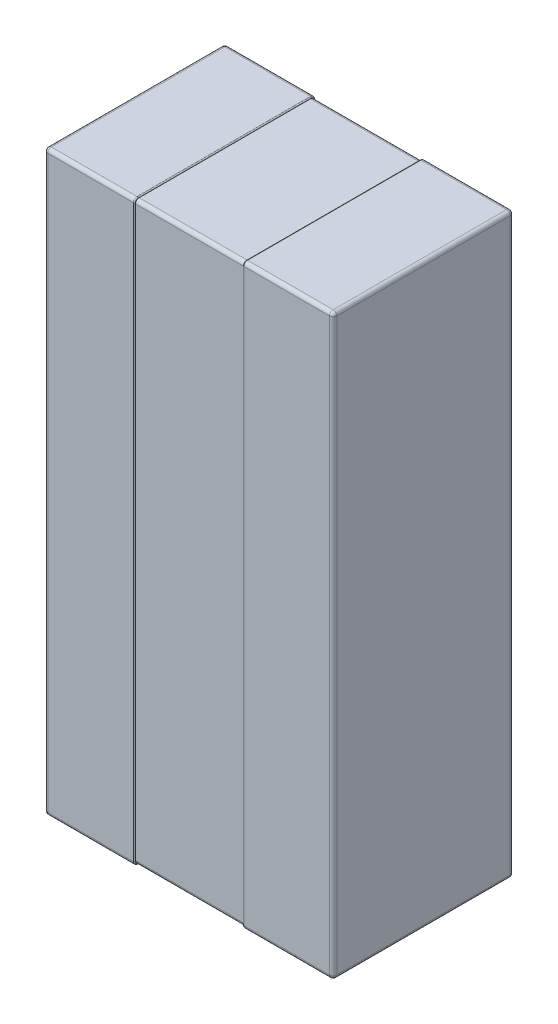
from build123d import *

# Parameters (mm, degrees)
SKETCH1_W                           = 0.8
SKETCH1_H                           = 1.6
ALL_BODY_DEPTH                      = 0.5
CUT_OUT_THE_BODY_FOR_PIN_DEPTH      = 0.15
CUT_OUT_THE_BODY_FOR_PIN_DEPTH_BACK = 0.15
SKETCH2_OUTSIDE_W                   = 2.872
SKETCH2_OUTSIDE_H                   = 3.972
SKETCH2_OUTSIDE_W_2                 = 0.494
SKETCH2_OUTSIDE_H_2                 = 1.594
BODY_FILLET_R                       = 0.01
PIN_FILLET_A_R                      = 0.01
PIN_FILLET_B_R                      = 0.003


with BuildPart() as part:
    # Sketch1 → All body (new body)
    with BuildSketch(Plane.XY):
        Rectangle(SKETCH1_W, SKETCH1_H)
    extrude(amount=ALL_BODY_DEPTH)

    # Sketch2 outside → Cut out the body for pin (cut, two sides: drawn at the far end of the back side and taken through both)
    with BuildSketch(Plane(origin=(0, 0, 0), x_dir=(0, 0, -1), z_dir=(1, 0, 0)).offset(-CUT_OUT_THE_BODY_FOR_PIN_DEPTH_BACK)):
        with Locations((-0.25, 0)):
            Rectangle(SKETCH2_OUTSIDE_W, SKETCH2_OUTSIDE_H)
        with Locations((-0.25, 0)):
            Rectangle(SKETCH2_OUTSIDE_W_2, SKETCH2_OUTSIDE_H_2, mode=Mode.SUBTRACT)
    extrude(amount=CUT_OUT_THE_BODY_FOR_PIN_DEPTH + CUT_OUT_THE_BODY_FOR_PIN_DEPTH_BACK, mode=Mode.SUBTRACT)

    # Body fillet
    body_fillet_edges = [part.edges().sort_by_distance(p)[0] for p in [
        (0, 0.797, 0.003),
        (0, 0.797, 0.497),
        (0, -0.797, 0.497),
        (0, -0.797, 0.003),
    ]]
    fillet(body_fillet_edges, radius=BODY_FILLET_R)

    # Pin fillet a
    pin_fillet_a_edges = [part.edges().sort_by_distance(p)[0] for p in [
        (0.4, 0, 0.5),
        (-0.275, 0.8, 0),
        (0.275, -0.8, 0),
        (0.275, -0.8, 0.5),
        (-0.275, 0.8, 0.5),
        (0.275, 0.8, 0.5),
        (-0.4, 0, 0.5),
        (0.275, 0.8, 0),
        (0.4, 0, 0),
        (-0.275, -0.8, 0),
        (-0.4, 0, 0),
        (-0.4, 0.8, 0.25),
        (0.4, 0.8, 0.25),
        (0.4, -0.8, 0.25),
        (-0.4, -0.8, 0.25),
        (-0.275, -0.8, 0.5),
    ]]
    fillet(pin_fillet_a_edges, radius=PIN_FILLET_A_R)

    # Pin fillet b
    pin_fillet_b_edges = [part.edges().sort_by_distance(p)[0] for p in [
        (0.15, -0.8, 0.25),
        (0.15, 0, 0.5),
        (0.15, 0.8, 0.25),
        (0.15, 0, 0),
        (-0.15, 0.8, 0.25),
        (-0.15, 0, 0.5),
        (-0.15, -0.8, 0.25),
        (-0.15, 0, 0),
        (0.15, 0.797071068, 0.002928932),
        (0.15, -0.797071068, 0.002928932),
        (0.15, -0.797071068, 0.497071068),
        (0.15, 0.797071068, 0.497071068),
        (-0.15, -0.797071068, 0.497071068),
        (-0.15, 0.797071068, 0.497071068),
        (-0.15, -0.797071068, 0.002928932),
        (-0.15, 0.797071068, 0.002928932),
    ]]
    fillet(pin_fillet_b_edges, radius=PIN_FILLET_B_R - 0.0001)  # a hair under: the kernel refuses the full size


solid = part.part
